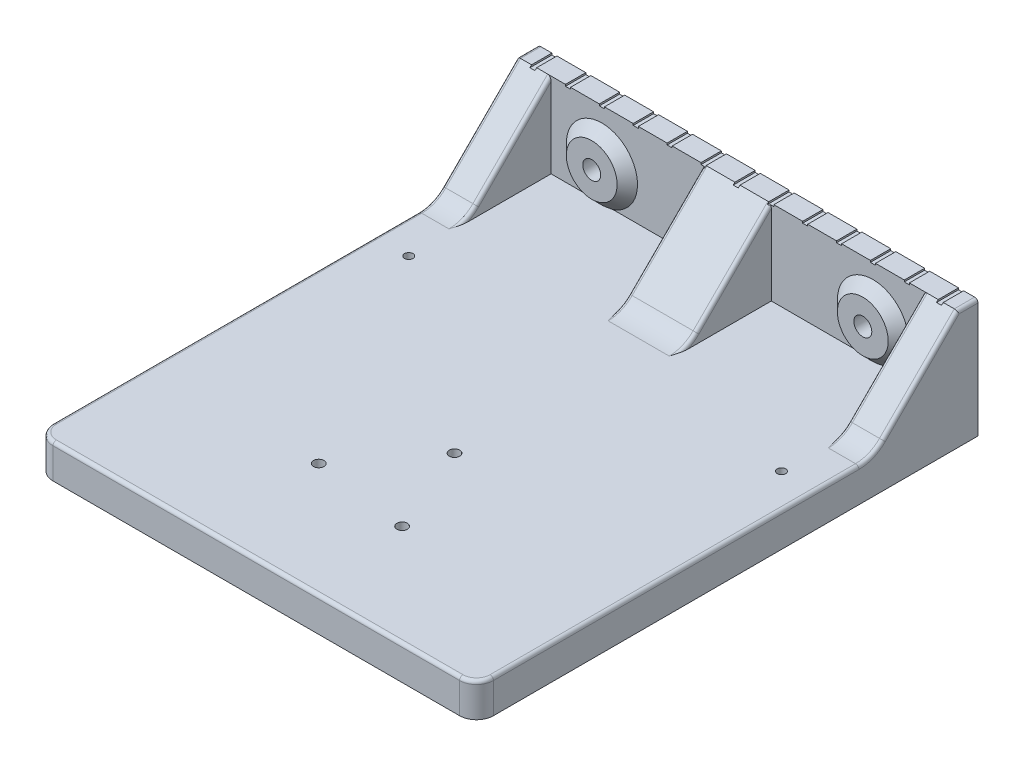
from build123d import *
from build123d.topology import SkipClean

# Parameters (mm, degrees)
AUFSATZ_LINEAR_AUSTRAGEN1_DEPTH             = 10
AUFSATZ_LINEAR_AUSTRAGEN2_REACH             = 128.448
AUFSATZ_LINEAR_AUSTRAGEN2_DIRECTION_2_REACH = 128.448
SCHNITT_LINEAR_AUSTRAGEN1_DEPTH             = 45
SCHNITT_LINEAR_AUSTRAGEN2_DEPTH             = 45
SKIZZE5_W                                   = 20
SKIZZE5_H                                   = 8
AUFSATZ_LINEAR_AUSTRAGEN3_DEPTH             = 2.5
SKIZZE6_R                                   = 2.65
SCHNITT_LINEAR_AUSTRAGEN3_DEPTH             = 168.631291828
VERRUNDUNG1_R                               = 10
VERRUNDUNG2_R                               = 5
SCHNITT_LINEAR_AUSTRAGEN4_REACH             = 134.892
SKIZZE7_R                                   = 1.55
SKIZZE8_R                                   = 2.85
SCHNITT_LINEAR_AUSTRAGEN5_DEPTH             = 3.2
SKIZZE9_W                                   = 1.5
SKIZZE9_H                                   = 10
SCHNITT_LINEAR_AUSTRAGEN6_DEPTH             = 0.5
LINEARES_MUSTER1_COUNT                      = 8
LINEARES_MUSTER1_PITCH                      = 10
LINEARES_MUSTER2_COUNT                      = 8
LINEARES_MUSTER2_PITCH                      = 10
VERRUNDUNG3_R                               = 1
SKIZZE10_R                                  = 7.5
SKIZZE10_R_2                                = 2.65
AUFSATZ_LINEAR_AUSTRAGEN4_DEPTH             = 3
FASE1_SIZE                                  = 3
SKIZZE11_R                                  = 1.25
SCHNITT_LINEAR_AUSTRAGEN8_DEPTH             = 133.891873341


with BuildPart() as part:
    # Skizze1 → Aufsatz-Linear austragen1 (new body)
    with BuildSketch(Plane(origin=(0, 0, 0), x_dir=(1, 0, 0), z_dir=(0, 1, 0))):
        Polygon((-65, -40), (-65, 0), (-65, 108), (65, 108), (65, 0), (65, -40), align=None)
    extrude(amount=AUFSATZ_LINEAR_AUSTRAGEN1_DEPTH)

    # Aufsatz-Linear austragen2: up to this face of the body (flat: up to its plane)
    aufsatz_linear_austragen2_end = Plane(part.part.faces().sort_by_distance((65, 5, -34))[0])
    # Skizze2 → Aufsatz-Linear austragen2 (add, up to the picked face)
    with BuildSketch(Plane(origin=(0, 0, 0), x_dir=(0, 0, -1), z_dir=(1, 0, 0)), mode=Mode.PRIVATE) as aufsatz_linear_austragen2_sk1:
        Polygon((108, 10), (108, 35), (102, 35), (77, 10), align=None)
    aufsatz_linear_austragen2_tool1 = split(extrude(aufsatz_linear_austragen2_sk1.sketch, amount=AUFSATZ_LINEAR_AUSTRAGEN2_REACH, mode=Mode.PRIVATE), bisect_by=aufsatz_linear_austragen2_end, keep=Keep.BOTH, mode=Mode.PRIVATE)
    add(aufsatz_linear_austragen2_tool1.solids().sort_by(Axis((0, 19.684685, -97.342342), (1, 0, 0)))[0])

    # Aufsatz-Linear austragen2 direction 2: up to this face of the body (flat: up to its plane)
    aufsatz_linear_austragen2_direction_2_end = Plane(part.part.faces().sort_by_distance((-65, 5, -34))[0])
    # Skizze2 → Aufsatz-Linear austragen2 direction 2 (add, up to the picked face)
    with BuildSketch(Plane(origin=(0, 0, 0), x_dir=(0, 0, -1), z_dir=(1, 0, 0)), mode=Mode.PRIVATE) as aufsatz_linear_austragen2_direction_2_sk1:
        Polygon((108, 10), (108, 35), (102, 35), (77, 10), align=None)
    aufsatz_linear_austragen2_direction_2_tool1 = split(extrude(aufsatz_linear_austragen2_direction_2_sk1.sketch, amount=-AUFSATZ_LINEAR_AUSTRAGEN2_DIRECTION_2_REACH, mode=Mode.PRIVATE), bisect_by=aufsatz_linear_austragen2_direction_2_end, keep=Keep.BOTH, mode=Mode.PRIVATE)
    add(aufsatz_linear_austragen2_direction_2_tool1.solids().sort_by(Axis((0, 19.684685, -97.342342), (-1, 0, 0)))[0])

    # Skizze3 → Schnitt-Linear austragen1 (cut)
    with BuildSketch(Plane(origin=(10, 0, 0), x_dir=(0, 0, -1), z_dir=(1, 0, 0))):
        Polygon((102, 35), (102, 10), (77, 10), align=None)
    extrude(amount=SCHNITT_LINEAR_AUSTRAGEN1_DEPTH, mode=Mode.SUBTRACT)

    # Skizze4 → Schnitt-Linear austragen2 (cut)
    with BuildSketch(Plane(origin=(-10, 0, 0), x_dir=(0, 0, -1), z_dir=(1, 0, 0))):
        Polygon((102, 35), (102, 10), (77, 10), align=None)
    extrude(amount=-SCHNITT_LINEAR_AUSTRAGEN2_DEPTH, mode=Mode.SUBTRACT)

    # Skizze5 → Aufsatz-Linear austragen3 (add)
    with BuildSketch(Plane(origin=(0, 0, -108), x_dir=(-1, 0, 0), z_dir=(0, 0, -1))):
        with Locations((-40, 20)):
            Rectangle(SKIZZE5_W, SKIZZE5_H)
        with Locations((40, 20)):
            Rectangle(SKIZZE5_W, SKIZZE5_H)
    extrude(amount=AUFSATZ_LINEAR_AUSTRAGEN3_DEPTH)

    # Skizze6 → Schnitt-Linear austragen3 (cut, through all)
    with BuildSketch(Plane(origin=(0, 0, -110.5), x_dir=(-1, 0, 0), z_dir=(0, 0, -1))):
        with Locations((-40, 20)):
            Circle(SKIZZE6_R)
        with Locations((40, 20)):
            Circle(SKIZZE6_R)
    extrude(amount=-SCHNITT_LINEAR_AUSTRAGEN3_DEPTH, mode=Mode.SUBTRACT)

    # Verrundung1
    verrundung1_edges = [part.edges().sort_by_distance(p)[0] for p in [
        (60, 10, -77),
        (0, 10, -77),
        (-60, 10, -77),
    ]]
    fillet(verrundung1_edges, radius=VERRUNDUNG1_R)

    # Verrundung2
    verrundung2_edges = [part.edges().sort_by_distance(p)[0] for p in [
        (65, 5, 40),
        (-65, 5, 40),
    ]]
    fillet(verrundung2_edges, radius=VERRUNDUNG2_R)

    # Skizze7 → Schnitt-Linear austragen4 (cut, up to next)
    with BuildSketch(Plane.XZ, mode=Mode.PRIVATE) as schnitt_linear_austragen4_sk1:
        with Locations(Location((-15.244012286, 6.314276634, 0), (0, 0, 270))):
            Circle(SKIZZE7_R)
    schnitt_linear_austragen4_tool1 = extrude(schnitt_linear_austragen4_sk1.sketch, amount=-SCHNITT_LINEAR_AUSTRAGEN4_REACH, mode=Mode.PRIVATE) & part.part
    # Skizze7 → Schnitt-Linear austragen4 (cut, up to next)
    with BuildSketch(Plane.XZ, mode=Mode.PRIVATE) as schnitt_linear_austragen4_sk2:
        with Locations(Location((13.090330115, 10.044563579, 0), (0, 0, 270))):
            Circle(SKIZZE7_R)
    schnitt_linear_austragen4_tool2 = extrude(schnitt_linear_austragen4_sk2.sketch, amount=-SCHNITT_LINEAR_AUSTRAGEN4_REACH, mode=Mode.PRIVATE) & part.part
    # Skizze7 → Schnitt-Linear austragen4 (cut, up to next)
    with BuildSketch(Plane.XZ, mode=Mode.PRIVATE) as schnitt_linear_austragen4_sk3:
        with Locations(Location((2.153682172, -16.358840213, 0), (0, 0, 270))):
            Circle(SKIZZE7_R)
    schnitt_linear_austragen4_tool3 = extrude(schnitt_linear_austragen4_sk3.sketch, amount=-SCHNITT_LINEAR_AUSTRAGEN4_REACH, mode=Mode.PRIVATE) & part.part
    add(schnitt_linear_austragen4_tool1.solids().sort_by_distance((-15.244012, 0, 6.314277))[0], mode=Mode.SUBTRACT)
    add(schnitt_linear_austragen4_tool2.solids().sort_by_distance((13.09033, 0, 10.044564))[0], mode=Mode.SUBTRACT)
    add(schnitt_linear_austragen4_tool3.solids().sort_by_distance((2.153682, 0, -16.35884))[0], mode=Mode.SUBTRACT)

    # Skizze8 → Schnitt-Linear austragen5 (cut)
    with BuildSketch(Plane.XZ):
        with Locations(Location((2.153682172, -16.358840213, 0), (0, 0, 270))):
            Circle(SKIZZE8_R)
        with Locations(Location((13.090330115, 10.044563579, 0), (0, 0, 270))):
            Circle(SKIZZE8_R)
        with Locations(Location((-15.244012286, 6.314276634, 0), (0, 0, 270))):
            Circle(SKIZZE8_R)
    extrude(amount=-SCHNITT_LINEAR_AUSTRAGEN5_DEPTH, mode=Mode.SUBTRACT)

    # Skizze9 → Schnitt-Linear austragen6 (cut)
    with BuildSketch(Plane(origin=(0, 35, 0), x_dir=(1, 0, 0), z_dir=(0, 1, 0))):
        with Locations((0, 103)):
            Rectangle(SKIZZE9_W, SKIZZE9_H)
    schnitt_linear_austragen6 = extrude(amount=-SCHNITT_LINEAR_AUSTRAGEN6_DEPTH, mode=Mode.SUBTRACT)

    # Lineares Muster1: Schnitt-Linear austragen6 ×8
    with Locations(*[(i * LINEARES_MUSTER1_PITCH, 0, 0) for i in range(1, LINEARES_MUSTER1_COUNT)]):
        add(schnitt_linear_austragen6, mode=Mode.SUBTRACT)

    # Lineares Muster2: Schnitt-Linear austragen6 ×8
    with Locations(*[(-i * LINEARES_MUSTER2_PITCH, 0, 0) for i in range(1, LINEARES_MUSTER2_COUNT)]):
        add(schnitt_linear_austragen6, mode=Mode.SUBTRACT)

    # Verrundung3
    # the kernel refuses this fillet: 1 mm, written as the material it takes off along each edge
    with BuildSketch(Plane(origin=(-55, 20, -72.857864376), x_dir=(0, -0.7316375364026848, 0.681693857480475), z_dir=(0, 0.681693857480475, 0.7316375364026848))) as verrundung3_piece_1_section:
        with BuildLine():
            CenterArc((10 + VERRUNDUNG3_R, -VERRUNDUNG3_R), VERRUNDUNG3_R, 90, 90)
            Line((10 + VERRUNDUNG3_R, 0), (10, 0))
            Line((10, 0), (10, -VERRUNDUNG3_R))
        make_face()
    verrundung3_piece_1 = revolve(axis=Axis((-55, 20, -72.857864376), (1, 0, 0)), revolution_arc=87.976149259, mode=Mode.PRIVATE)
    verrundung3_piece_1 = split(verrundung3_piece_1, bisect_by=Plane(origin=(-55, 10, -72.857864376), z_dir=(0, 1, 0)), keep=Keep.TOP, mode=Mode.PRIVATE)
    add(verrundung3_piece_1, mode=Mode.SUBTRACT)
    with BuildSketch(Plane(origin=(-10, 20, -72.857864376), x_dir=(0, -0.7316375364026848, 0.681693857480475), z_dir=(0, 0.681693857480475, 0.7316375364026848))) as verrundung3_piece_2_section:
        with BuildLine():
            CenterArc((10 + VERRUNDUNG3_R, VERRUNDUNG3_R), VERRUNDUNG3_R, 180, 90)
            Line((10 + VERRUNDUNG3_R, 0), (10, 0))
            Line((10, 0), (10, VERRUNDUNG3_R))
        make_face()
    verrundung3_piece_2 = revolve(axis=Axis((-10, 20, -72.857864376), (1, 0, 0)), revolution_arc=87.976149259, mode=Mode.PRIVATE)
    verrundung3_piece_2 = split(verrundung3_piece_2, bisect_by=Plane(origin=(-10, 10, -72.857864376), z_dir=(0, 1, 0)), keep=Keep.TOP, mode=Mode.PRIVATE)
    add(verrundung3_piece_2, mode=Mode.SUBTRACT)
    with BuildSketch(Plane(origin=(10, 20, -72.857864376), x_dir=(0, -0.7316375364026848, 0.681693857480475), z_dir=(0, 0.681693857480475, 0.7316375364026848))) as verrundung3_piece_3_section:
        with BuildLine():
            CenterArc((10 + VERRUNDUNG3_R, -VERRUNDUNG3_R), VERRUNDUNG3_R, 90, 90)
            Line((10, -VERRUNDUNG3_R), (10, 0))
            Line((10, 0), (10 + VERRUNDUNG3_R, 0))
        make_face()
    verrundung3_piece_3 = revolve(axis=Axis((10, 20, -72.857864376), (1, 0, 0)), revolution_arc=87.976149259, mode=Mode.PRIVATE)
    verrundung3_piece_3 = split(verrundung3_piece_3, bisect_by=Plane(origin=(10, 10, -72.857864376), z_dir=(0, 1, 0)), keep=Keep.TOP, mode=Mode.PRIVATE)
    add(verrundung3_piece_3, mode=Mode.SUBTRACT)
    with BuildSketch(Plane(origin=(55, 20, -72.857864376), x_dir=(0, -0.7316375364026848, 0.681693857480475), z_dir=(0, 0.681693857480475, 0.7316375364026848))) as verrundung3_piece_4_section:
        with BuildLine():
            CenterArc((10 + VERRUNDUNG3_R, VERRUNDUNG3_R), VERRUNDUNG3_R, 180, 90)
            Line((10 + VERRUNDUNG3_R, 0), (10, 0))
            Line((10, 0), (10, VERRUNDUNG3_R))
        make_face()
    verrundung3_piece_4 = revolve(axis=Axis((55, 20, -72.857864376), (1, 0, 0)), revolution_arc=87.976149259, mode=Mode.PRIVATE)
    verrundung3_piece_4 = split(verrundung3_piece_4, bisect_by=Plane(origin=(55, 10, -72.857864376), z_dir=(0, 1, 0)), keep=Keep.TOP, mode=Mode.PRIVATE)
    add(verrundung3_piece_4, mode=Mode.SUBTRACT)
    with BuildSketch(Plane(origin=(-65, 36.767766953, -103.767766953), x_dir=(1.421085471520189e-14, -0.7071067811865517, -0.7071067811865435), z_dir=(0, -0.7071067811865435, 0.7071067811865517))) as verrundung3_piece_5:
        with BuildLine():
            CenterArc((VERRUNDUNG3_R, VERRUNDUNG3_R), VERRUNDUNG3_R, 180, 90)
            Line((0, VERRUNDUNG3_R), (0, 0))
            Line((0, 0), (VERRUNDUNG3_R, 0))
        make_face()
    extrude(amount=33.713203436, mode=Mode.SUBTRACT)
    with BuildSketch(Plane(origin=(-55, 12.928932188, -79.928932188), x_dir=(-1, 0, 0), z_dir=(0, 0.7071067811865436, -0.7071067811865515))) as verrundung3_piece_6_section:
        with BuildLine():
            CenterArc((VERRUNDUNG3_R, -VERRUNDUNG3_R), VERRUNDUNG3_R, 90, 90)
            Line((0, -VERRUNDUNG3_R), (0, 0))
            Line((0, 0), (VERRUNDUNG3_R, 0))
        make_face()
    verrundung3_piece_6 = extrude(amount=33.713203436, mode=Mode.PRIVATE)
    verrundung3_piece_6 = split(verrundung3_piece_6, bisect_by=Plane(origin=(-55, 12.928932188, -102), z_dir=(0, 0, 1)), keep=Keep.TOP, mode=Mode.PRIVATE)
    add(verrundung3_piece_6, mode=Mode.SUBTRACT)
    with BuildSketch(Plane(origin=(-65, 20, -72.857864376), x_dir=(0, -1, 0), z_dir=(0, 0, 1))) as verrundung3_piece_7:
        with BuildLine():
            CenterArc((10 + VERRUNDUNG3_R, VERRUNDUNG3_R), VERRUNDUNG3_R, 180, 90)
            Line((10, VERRUNDUNG3_R), (10, 0))
            Line((10, 0), (10 + VERRUNDUNG3_R, 0))
        make_face()
    revolve(axis=Axis((-65, 20, -72.857864376), (1, 0, 0)), revolution_arc=45, mode=Mode.SUBTRACT)
    with BuildSketch(Plane(origin=(-65, 10, 35), x_dir=(0, -1, 0), z_dir=(0, 0, -1))) as verrundung3_piece_8:
        with BuildLine():
            CenterArc((VERRUNDUNG3_R, -VERRUNDUNG3_R), VERRUNDUNG3_R, 90, 90)
            Line((0, -VERRUNDUNG3_R), (0, 0))
            Line((0, 0), (VERRUNDUNG3_R, 0))
        make_face()
    extrude(amount=107.857864376, mode=Mode.SUBTRACT)
    with BuildSketch(Plane(origin=(-60, 10, 35), x_dir=(-1, 0, 0), z_dir=(0, 0, -1))) as verrundung3_piece_9:
        with BuildLine():
            CenterArc((5 - VERRUNDUNG3_R, -VERRUNDUNG3_R), VERRUNDUNG3_R, 0, 90)
            Line((5, -VERRUNDUNG3_R), (5, 0))
            Line((5, 0), (5 - VERRUNDUNG3_R, 0))
        make_face()
    revolve(axis=Axis((-60, 10, 35), (0, 1, 0)), revolution_arc=90, mode=Mode.SUBTRACT)
    with BuildSketch(Plane(origin=(55, 12.928932188, -79.928932188), x_dir=(0, -0.7071067811865513, -0.7071067811865438), z_dir=(0, 0.7071067811865438, -0.7071067811865513))) as verrundung3_piece_10_section:
        with BuildLine():
            CenterArc((VERRUNDUNG3_R, -VERRUNDUNG3_R), VERRUNDUNG3_R, 90, 90)
            Line((0, -VERRUNDUNG3_R), (0, 0))
            Line((0, 0), (VERRUNDUNG3_R, 0))
        make_face()
    verrundung3_piece_10 = extrude(amount=33.713203436, mode=Mode.PRIVATE)
    verrundung3_piece_10 = split(verrundung3_piece_10, bisect_by=Plane(origin=(55, 12.928932188, -102), z_dir=(0, 0, 1)), keep=Keep.TOP, mode=Mode.PRIVATE)
    add(verrundung3_piece_10, mode=Mode.SUBTRACT)
    with BuildSketch(Plane(origin=(65, 36.767766953, -103.767766953), x_dir=(0, -0.7071067811865517, -0.7071067811865435), z_dir=(0, -0.7071067811865435, 0.7071067811865517))) as verrundung3_piece_11:
        with BuildLine():
            CenterArc((VERRUNDUNG3_R, -VERRUNDUNG3_R), VERRUNDUNG3_R, 90, 90)
            Line((0, -VERRUNDUNG3_R), (0, 0))
            Line((0, 0), (VERRUNDUNG3_R, 0))
        make_face()
    extrude(amount=33.713203436, mode=Mode.SUBTRACT)
    with BuildSketch(Plane(origin=(65, 20, -72.857864376), x_dir=(0, -1, 0), z_dir=(0, 0, 1))) as verrundung3_piece_12:
        with BuildLine():
            CenterArc((10 + VERRUNDUNG3_R, -VERRUNDUNG3_R), VERRUNDUNG3_R, 90, 90)
            Line((10, -VERRUNDUNG3_R), (10, 0))
            Line((10, 0), (10 + VERRUNDUNG3_R, 0))
        make_face()
    revolve(axis=Axis((65, 20, -72.857864376), (1, 0, 0)), revolution_arc=45, mode=Mode.SUBTRACT)
    with BuildSketch(Plane(origin=(65, 10, -72.857864376), x_dir=(-1, 0, 0), z_dir=(0, 0, 1))) as verrundung3_piece_13:
        with BuildLine():
            CenterArc((VERRUNDUNG3_R, VERRUNDUNG3_R), VERRUNDUNG3_R, 180, 90)
            Line((0, VERRUNDUNG3_R), (0, 0))
            Line((0, 0), (VERRUNDUNG3_R, 0))
        make_face()
    extrude(amount=107.857864376, mode=Mode.SUBTRACT)
    with BuildSketch(Plane(origin=(60, 10, 35), x_dir=(1, 0, 0), z_dir=(0, 0, -1))) as verrundung3_piece_14:
        with BuildLine():
            CenterArc((5 - VERRUNDUNG3_R, VERRUNDUNG3_R), VERRUNDUNG3_R, 270, 90)
            Line((5, VERRUNDUNG3_R), (5, 0))
            Line((5, 0), (5 - VERRUNDUNG3_R, 0))
        make_face()
    revolve(axis=Axis((60, 10, 35), (0, -1, 0)), revolution_arc=90, mode=Mode.SUBTRACT)
    with BuildSketch(Plane(origin=(-10, 12.928932188, -79.928932188), x_dir=(0, -0.7071067811865516, -0.7071067811865436), z_dir=(0, 0.7071067811865436, -0.7071067811865515))) as verrundung3_piece_15_section:
        with BuildLine():
            CenterArc((VERRUNDUNG3_R, -VERRUNDUNG3_R), VERRUNDUNG3_R, 90, 90)
            Line((0, -VERRUNDUNG3_R), (0, 0))
            Line((0, 0), (VERRUNDUNG3_R, 0))
        make_face()
    verrundung3_piece_15 = extrude(amount=33.006096654, mode=Mode.PRIVATE)
    verrundung3_piece_15 = split(verrundung3_piece_15, bisect_by=Plane(origin=(-10, 12.928932188, -102), z_dir=(0, 0, 1)), keep=Keep.TOP, mode=Mode.PRIVATE)
    add(verrundung3_piece_15, mode=Mode.SUBTRACT)
    with BuildSketch(Plane(origin=(-10, 12.928932188, -79.928932188), x_dir=(0, -0.7071067811865516, -0.7071067811865436), z_dir=(0, 0.7071067811865436, -0.7071067811865515))) as verrundung3_piece_16_section:
        with BuildLine():
            CenterArc((VERRUNDUNG3_R, -VERRUNDUNG3_R), VERRUNDUNG3_R, 90, 90)
            Line((0, -VERRUNDUNG3_R), (0, 0))
            Line((0, 0), (VERRUNDUNG3_R, 0))
        make_face()
    verrundung3_piece_16 = extrude(amount=33.006096654, mode=Mode.PRIVATE)
    verrundung3_piece_16 = split(verrundung3_piece_16, bisect_by=Plane(origin=(-9.25, 12.928932188, -79.928932188), z_dir=(1, 0, 0)), keep=Keep.TOP, mode=Mode.PRIVATE)
    add(verrundung3_piece_16, mode=Mode.SUBTRACT)
    with BuildSketch(Plane(origin=(10, 12.928932188, -79.928932188), x_dir=(0, -0.7071067811865513, -0.7071067811865438), z_dir=(0, 0.7071067811865438, -0.7071067811865513))) as verrundung3_piece_17_section:
        with BuildLine():
            CenterArc((VERRUNDUNG3_R, VERRUNDUNG3_R), VERRUNDUNG3_R, 180, 90)
            Line((0, VERRUNDUNG3_R), (0, 0))
            Line((0, 0), (VERRUNDUNG3_R, 0))
        make_face()
    verrundung3_piece_17 = extrude(amount=33.006096654, mode=Mode.PRIVATE)
    verrundung3_piece_17 = split(verrundung3_piece_17, bisect_by=Plane(origin=(10, 12.928932188, -102), z_dir=(0, 0, 1)), keep=Keep.TOP, mode=Mode.PRIVATE)
    add(verrundung3_piece_17, mode=Mode.SUBTRACT)
    with BuildSketch(Plane(origin=(10, 12.928932188, -79.928932188), x_dir=(0, -0.7071067811865513, -0.7071067811865438), z_dir=(0, 0.7071067811865438, -0.7071067811865513))) as verrundung3_piece_18_section:
        with BuildLine():
            CenterArc((VERRUNDUNG3_R, VERRUNDUNG3_R), VERRUNDUNG3_R, 180, 90)
            Line((0, VERRUNDUNG3_R), (0, 0))
            Line((0, 0), (VERRUNDUNG3_R, 0))
        make_face()
    verrundung3_piece_18 = extrude(amount=33.006096654, mode=Mode.PRIVATE)
    verrundung3_piece_18 = split(verrundung3_piece_18, bisect_by=Plane(origin=(10, 34.5, -79.928932188), z_dir=(0, 1, 0)), keep=Keep.TOP, mode=Mode.PRIVATE)
    add(verrundung3_piece_18, mode=Mode.SUBTRACT)
    with BuildSketch(Plane(origin=(65, 35, -110.5), x_dir=(0, -1, 0), z_dir=(0, 0, 1))) as verrundung3_piece_19:
        with BuildLine():
            CenterArc((VERRUNDUNG3_R, -VERRUNDUNG3_R), VERRUNDUNG3_R, 90, 90)
            Line((0, -VERRUNDUNG3_R), (0, 0))
            Line((0, 0), (VERRUNDUNG3_R, 0))
        make_face()
    extrude(amount=11, mode=Mode.SUBTRACT)
    with BuildSketch(Plane(origin=(-65, 35, -110.5), x_dir=(0, -1, 0), z_dir=(0, 0, 1))) as verrundung3_piece_20:
        with BuildLine():
            CenterArc((VERRUNDUNG3_R, VERRUNDUNG3_R), VERRUNDUNG3_R, 180, 90)
            Line((0, VERRUNDUNG3_R), (0, 0))
            Line((0, 0), (VERRUNDUNG3_R, 0))
        make_face()
    extrude(amount=11, mode=Mode.SUBTRACT)
    with BuildSketch(Plane(origin=(60, 10, 40), x_dir=(0, 0, -1), z_dir=(-1, 0, 0))) as verrundung3_piece_21:
        with BuildLine():
            CenterArc((VERRUNDUNG3_R, VERRUNDUNG3_R), VERRUNDUNG3_R, 180, 90)
            Line((0, VERRUNDUNG3_R), (0, 0))
            Line((0, 0), (VERRUNDUNG3_R, 0))
        make_face()
    extrude(amount=120, mode=Mode.SUBTRACT)

    # Skizze10 → Aufsatz-Linear austragen4 (add)
    # profile 1 of 2: a face of its own
    with SkipClean():  # the faces are left unmerged after this step: merging them gives an invalid solid
        with BuildSketch(Plane.XY.offset(-102)):
            with Locations(Location((-40, 20, 0), (0, 0, 180))):
                Circle(SKIZZE10_R)
            with Locations((-40, 20)):
                Circle(SKIZZE10_R_2, mode=Mode.SUBTRACT)
        # profile 2 of 2: a face of its own
        with BuildSketch(Plane.XY.offset(-102)):
            with Locations(Location((40, 20, 0), (0, 0, 180))):
                Circle(SKIZZE10_R)
            with Locations(Location((40, 20, 0), (0, 0, 180))):
                Circle(SKIZZE10_R_2, mode=Mode.SUBTRACT)
        extrude(amount=AUFSATZ_LINEAR_AUSTRAGEN4_DEPTH)
    add(part.part.scale(1), mode=Mode.REPLACE)  # the faces are merged on a copy

    # Fase1
    # the kernel refuses this chamfer: 3 mm, written as the material it adds along each edge
    with BuildSketch(Plane(origin=(-40, 20, -102), x_dir=(-1, 0, 0), z_dir=(0, 1, 0))) as fase1_piece_1_section:
        Polygon((7.5 + FASE1_SIZE, 0), (7.5, FASE1_SIZE), (7.5, 0), align=None)
    fase1_piece_1 = revolve(axis=Axis((-40, 20, -102), (0, 0, 1)), mode=Mode.PRIVATE)
    fase1_piece_1 = split(fase1_piece_1, bisect_by=Plane(origin=(-40, 20, -99), z_dir=(0, 0, -1)), keep=Keep.TOP, mode=Mode.PRIVATE)
    add(fase1_piece_1)
    with BuildSketch(Plane(origin=(40, 20, -102), x_dir=(-1, 0, 0), z_dir=(0, 1, 0))) as fase1_piece_2_section:
        Polygon((7.5 + FASE1_SIZE, 0), (7.5, FASE1_SIZE), (7.5, 0), align=None)
    fase1_piece_2 = revolve(axis=Axis((40, 20, -102), (0, 0, 1)), mode=Mode.PRIVATE)
    fase1_piece_2 = split(fase1_piece_2, bisect_by=Plane(origin=(40, 20, -99), z_dir=(0, 0, -1)), keep=Keep.TOP, mode=Mode.PRIVATE)
    add(fase1_piece_2)

    # Skizze11 → Schnitt-Linear austragen8 (cut, through all)
    with BuildSketch(Plane(origin=(0, 0, 0), x_dir=(1, 0, 0), z_dir=(0, 1, 0))):
        with Locations(Location((-55, 60, 0), (0, 0, 90))):
            Circle(SKIZZE11_R)
        with Locations(Location((55, 60, 0), (0, 0, 90))):
            Circle(SKIZZE11_R)
    extrude(amount=SCHNITT_LINEAR_AUSTRAGEN8_DEPTH, mode=Mode.SUBTRACT)


solid = part.part
